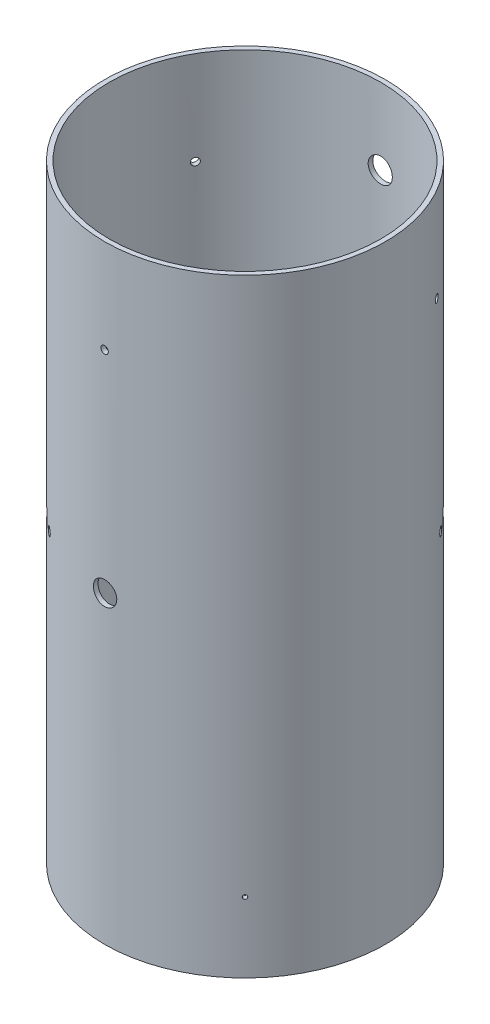
from build123d import *

# Parameters (mm, degrees)
SKETCH1_R               = 76.1746
SKETCH1_R_2             = 73.66
BOSS_EXTRUDE1_DEPTH     = 330.2
CUT_EXTRUDE1_DEPTH      = 348.328633238
CUT_EXTRUDE1_DEPTH_BACK = 348.328633238
SKETCH27_R              = 6.35
CUT_EXTRUDE2_DEPTH      = 348.328633238
CUT_EXTRUDE2_DEPTH_BACK = 348.328633238
SKETCH30_R              = 2.18313
SKETCH30_W              = 9.906
SKETCH30_H              = 9.906
SKETCH23_R              = 1.0922
SHEAR_SCRREWS_DEPTH     = 348.328633238
CIRPATTERN1_COUNT       = 4
CIRPATTERN2_COUNT       = 3


with BuildPart() as part:
    # Sketch1 → Boss-Extrude1 (new body)
    with BuildSketch(Plane(origin=(0, 0, 0), x_dir=(1, 0, 0), z_dir=(0, 1, 0))):
        Circle(SKETCH1_R)
        Circle(SKETCH1_R_2, mode=Mode.SUBTRACT)
    extrude(amount=BOSS_EXTRUDE1_DEPTH)

    # Sketch17 → 1/2 Clearance Hole5 (revolve, cut)
    with BuildSketch(Plane(origin=(0, 288.925, 0), x_dir=(0, -1, 0), z_dir=(1, 0, 0))):
        Polygon((0, 0), (0, 80.134507437), (6.54812, 76.2), (6.54812, 0), align=None)
    revolve(axis=Axis((0, 288.925, 6.35), (0, 0, -1)), mode=Mode.SUBTRACT)

    # Sketch27 → Cut-Extrude1 (cut, two sides: drawn at the far end of the back side and taken through both)
    with BuildSketch(Plane.XY.offset(-CUT_EXTRUDE1_DEPTH_BACK)):
        with Locations((0, 165.1)):
            Circle(SKETCH27_R)
    extrude(amount=CUT_EXTRUDE1_DEPTH + CUT_EXTRUDE1_DEPTH_BACK, mode=Mode.SUBTRACT)

    # Sketch30 → Cut-Extrude2 (cut, two sides: drawn at the far end of the back side and taken through both)
    with BuildSketch(Plane(origin=(0, 0, 0), x_dir=(0.7071067811865477, 0, 0.7071067811865475), z_dir=(-0.7071067811865475, 0, 0.7071067811865477)).offset(-CUT_EXTRUDE2_DEPTH_BACK)):
        with Locations((-12.7, 165.1)):
            Circle(SKETCH30_R)
        with Locations((12.7, 165.1)):
            Circle(SKETCH30_R)
        with Locations((0, 165.1)):
            Rectangle(SKETCH30_W, SKETCH30_H)
    extrude(amount=CUT_EXTRUDE2_DEPTH + CUT_EXTRUDE2_DEPTH_BACK, mode=Mode.SUBTRACT)

    # Sketch23 → Shear Scrrews (cut, through all)
    with BuildSketch(Plane(origin=(0, 0, 0), x_dir=(0.7071067811865477, 0, 0.7071067811865475), z_dir=(-0.7071067811865475, 0, 0.7071067811865477))):
        with Locations((0, 38.1)):
            Circle(SKETCH23_R)
    shear_scrrews = extrude(amount=-SHEAR_SCRREWS_DEPTH, mode=Mode.SUBTRACT)

    # CirPattern1: Shear Scrrews ×4 about axis
    cirpattern1_axis = Axis((0, 330.2, 0), (0, -1, 0))
    for i in range(1, CIRPATTERN1_COUNT):
        add(shear_scrrews.rotate(cirpattern1_axis, i * 360 / CIRPATTERN1_COUNT), mode=Mode.SUBTRACT)

    # Sketch25 → Ø4.0 (4) Diameter Hole1 (revolve, cut)
    with BuildSketch(Plane(origin=(0, 279.4, 0), x_dir=(0, 1, 0), z_dir=(1, 0, 0))):
        Polygon((0, 0), (0, 90.101721238), (2, 88.9), (2, 0), align=None)
    f_4_0_4_diameter_hole1 = revolve(axis=Axis((0, 279.4, -6.35), (0, 0, 1)), mode=Mode.SUBTRACT)

    # CirPattern2: Ø4.0 (4) Diameter Hole1 ×3 about axis
    cirpattern2_axis = Axis((0, 330.2, 0), (0, 1, 0))
    for i in range(1, CIRPATTERN2_COUNT):
        add(f_4_0_4_diameter_hole1.rotate(cirpattern2_axis, i * 360 / CIRPATTERN2_COUNT), mode=Mode.SUBTRACT)


solid = part.part
